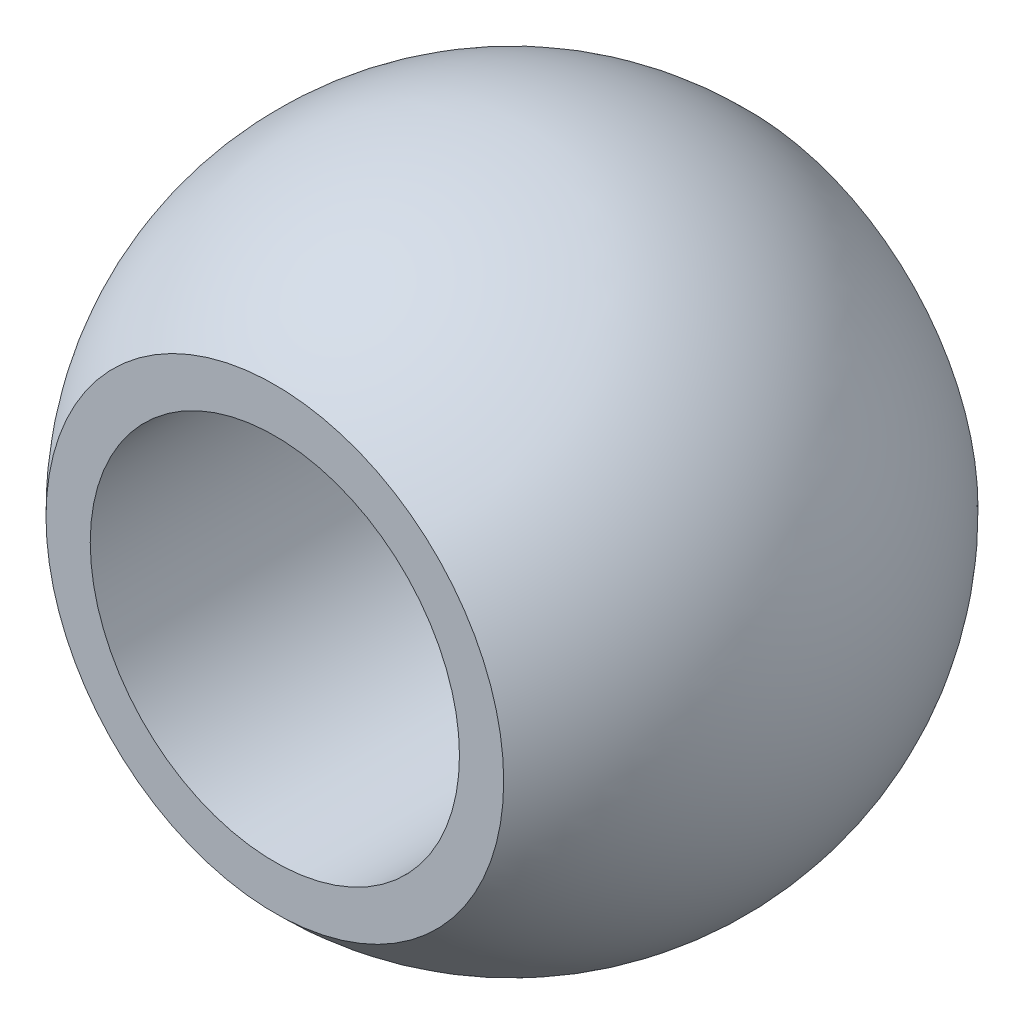
from build123d import *

# Parameters (mm, degrees)
CUT_EXTRUDE3_DEPTH      = 18.179692345
CUT_EXTRUDE3_DEPTH_BACK = 18.179692345
SKETCH4_R               = 5.55625
CUT_EXTRUDE4_DEPTH      = 18.179692345
CUT_EXTRUDE4_DEPTH_BACK = 18.179692345
SKETCH3_OUTSIDE_W       = 28.71
SKETCH3_OUTSIDE_H       = 28.71
SKETCH3_OUTSIDE_W_2     = 39.998671672
SKETCH3_OUTSIDE_H_2     = 14.2748


with BuildPart() as part:
    # Sketch2 → Revolve2 (revolve)
    with BuildSketch(Plane.XY):
        with BuildLine():
            Line((0, 9.9187), (0, -9.9187))
            ThreePointArc((0, -9.9187), (9.9187, 0), (0, 9.9187))
        make_face()
    revolve(axis=Axis((0, 12.922977109, 0), (0, -1, 0)))

    # Sketch4 → Cut-Extrude3 (cut, two sides: drawn at the far end of the back side and taken through both)
    with BuildSketch(Plane.XY.offset(-CUT_EXTRUDE3_DEPTH_BACK)):
        Circle(SKETCH4_R)
    extrude(amount=CUT_EXTRUDE3_DEPTH + CUT_EXTRUDE3_DEPTH_BACK, mode=Mode.SUBTRACT)

    # Sketch3 outside → Cut-Extrude4 (cut, two sides: drawn at the far end of the back side and taken through both)
    with BuildSketch(Plane(origin=(0, 0, 0), x_dir=(1, 0, 0), z_dir=(0, 1, 0)).offset(-CUT_EXTRUDE4_DEPTH_BACK)):
        Rectangle(SKETCH3_OUTSIDE_W, SKETCH3_OUTSIDE_H)
        Rectangle(SKETCH3_OUTSIDE_W_2, SKETCH3_OUTSIDE_H_2, mode=Mode.SUBTRACT)
    extrude(amount=CUT_EXTRUDE4_DEPTH + CUT_EXTRUDE4_DEPTH_BACK, mode=Mode.SUBTRACT)


solid = part.part
